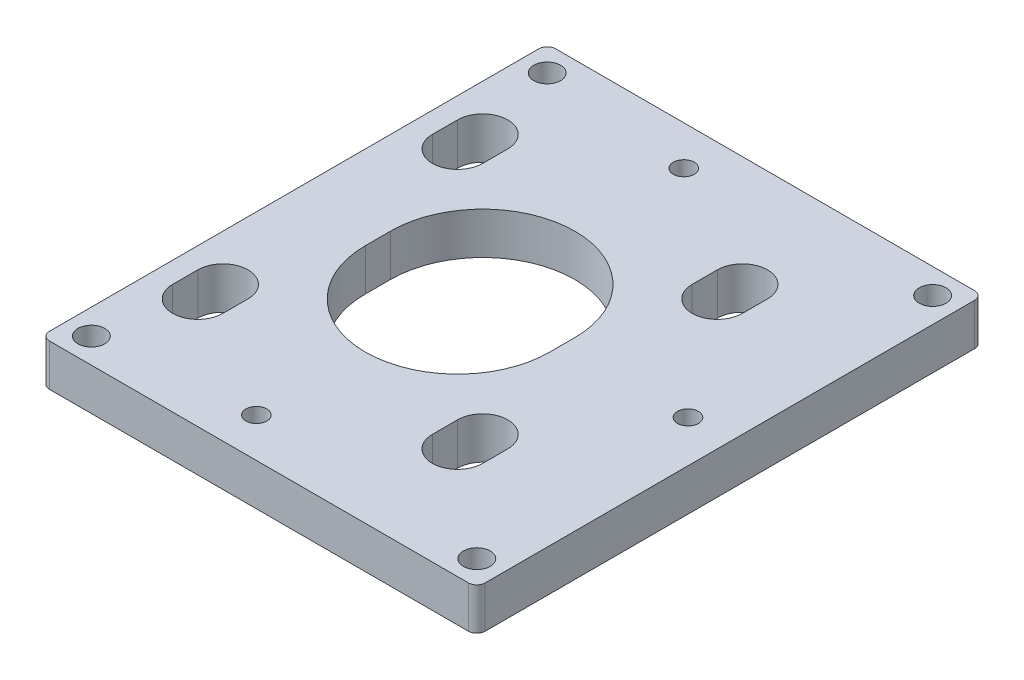
from build123d import *

# Parameters (mm, degrees)
SKETCH1_W                   = 52
SKETCH1_H                   = 60.4
BOSS_EXTRUDE1_DEPTH         = 5
M3_CLEARANCE_HOLE1_D        = 3.2
FILLET1_R                   = 1
TAP_DRILL_FOR_M3X0_5_TAP1_D = 2.5


with BuildPart() as part:
    # Sketch1 → Boss-Extrude1 (new body)
    with BuildSketch(Plane(origin=(0, 0, 0), x_dir=(1, 0, 0), z_dir=(0, 1, 0))):
        with Locations((5, 0)):
            Rectangle(SKETCH1_W, SKETCH1_H)
        with BuildLine():
            Line((-11, -1.5), (-11, 1.5))
            ThreePointArc((-11, 1.5), (0, 12.5), (11, 1.5))
            Line((11, 1.5), (11, -1.5))
            ThreePointArc((11, -1.5), (0, -12.5), (-11, -1.5))
        make_face(mode=Mode.SUBTRACT)
        with BuildLine():
            Line((-18.5, 14), (-18.5, 17))
            ThreePointArc((-18.5, 17), (-15.5, 20), (-12.5, 17))
            Line((-12.5, 17), (-12.5, 14))
            ThreePointArc((-12.5, 14), (-15.5, 11), (-18.5, 14))
        make_face(mode=Mode.SUBTRACT)
        with BuildLine():
            Line((12.5, 14), (12.5, 17))
            ThreePointArc((12.5, 17), (15.5, 20), (18.5, 17))
            Line((18.5, 17), (18.5, 14))
            ThreePointArc((18.5, 14), (15.5, 11), (12.5, 14))
        make_face(mode=Mode.SUBTRACT)
        with BuildLine():
            Line((12.5, -17), (12.5, -14))
            ThreePointArc((12.5, -14), (15.5, -11), (18.5, -14))
            Line((18.5, -14), (18.5, -17))
            ThreePointArc((18.5, -17), (15.5, -20), (12.5, -17))
        make_face(mode=Mode.SUBTRACT)
        with BuildLine():
            Line((-18.5, -17), (-18.5, -14))
            ThreePointArc((-18.5, -14), (-15.5, -11), (-12.5, -14))
            Line((-12.5, -14), (-12.5, -17))
            ThreePointArc((-12.5, -17), (-15.5, -20), (-18.5, -17))
        make_face(mode=Mode.SUBTRACT)
    extrude(amount=BOSS_EXTRUDE1_DEPTH)

    # M3 Clearance Hole1 (through all)
    with Locations(Plane(origin=(0, 5, 0), x_dir=(1, 0, 0), z_dir=(0, 1, 0))):
        with Locations((-18, -27.2), (28, -27.2), (28, 27.2), (-18, 27.2)):
            Hole(M3_CLEARANCE_HOLE1_D / 2)

    # Fillet1
    fillet1_edges = [part.edges().sort_by_distance(p)[0] for p in [
        (31, 2.5, -30.2),
        (-21, 2.5, -30.2),
        (31, 2.5, 30.2),
        (-21, 2.5, 30.2),
    ]]
    fillet(fillet1_edges, radius=FILLET1_R)

    # Tap Drill for M3x0.5 Tap1 (through all)
    with Locations(Plane(origin=(0, 5, 0), x_dir=(1, 0, 0), z_dir=(0, 1, 0))):
        with Locations((26, 0), (0, 25.5), (0, -25.5)):
            Hole(TAP_DRILL_FOR_M3X0_5_TAP1_D / 2)


solid = part.part
